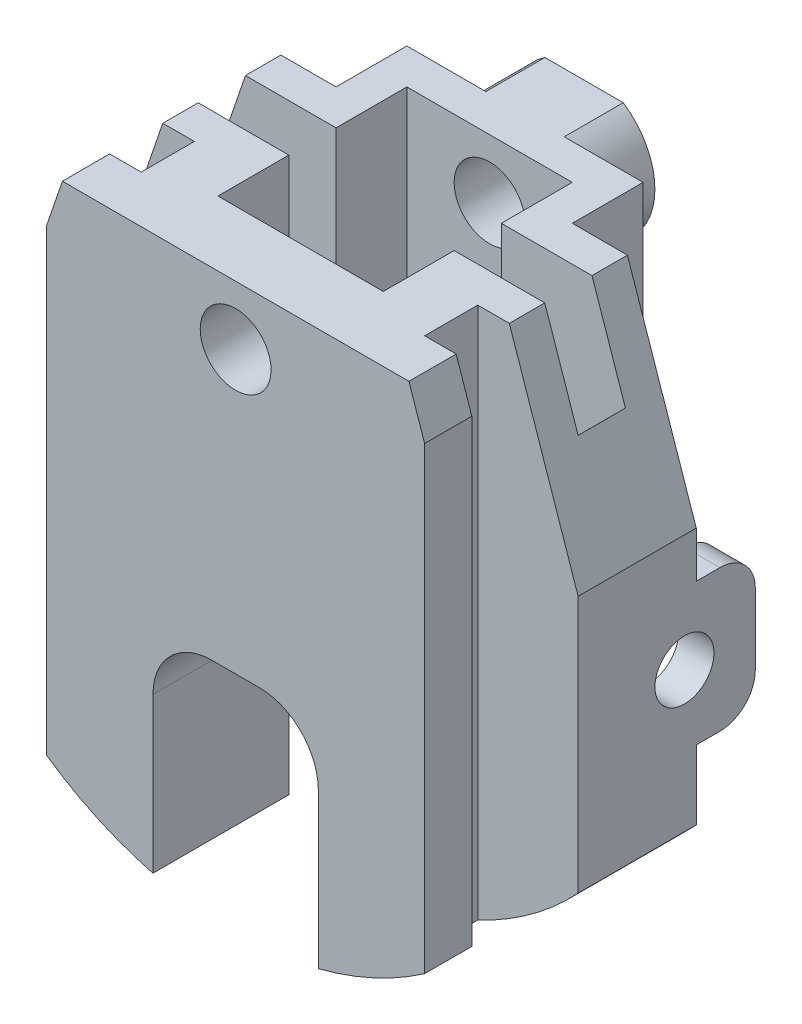
from build123d import *

# Parameters (mm, degrees)
BOSS_EXTRUDE1_DEPTH     = 18
SKETCH2_R               = 3
BOSS_EXTRUDE2_DEPTH     = 5
SKETCH2_3_R             = 3
CUT_EXTRUDE1_DEPTH      = 49.664668909
SKETCH1_3_W             = 2
SKETCH1_3_H             = 4.5
BOSS_EXTRUDE3_DEPTH     = 30
SKETCH3_OUTSIDE_W       = 56.936
SKETCH3_OUTSIDE_H       = 63.936
SKETCH3_OUTSIDE_R       = 28
CUT_EXTRUDE2_DEPTH      = 57.69435598
CUT_EXTRUDE3_START      = -18.5
CUT_EXTRUDE3_DEPTH      = 18.5
CUT_EXTRUDE4_DEPTH      = 57.587476675
CUT_EXTRUDE4_DEPTH_BACK = 10
SKETCH7_R               = 2.5
BOSS_EXTRUDE4_DEPTH     = 3
BOSS_EXTRUDE6_START     = -3
BOSS_EXTRUDE6_DEPTH     = 3
BOSS_EXTRUDE7_START     = -3
BOSS_EXTRUDE7_DEPTH     = 3
BOSS_EXTRUDE8_START     = -3
BOSS_EXTRUDE8_DEPTH     = 3
CUT_EXTRUDE5_DEPTH      = 43.804159814
CUT_EXTRUDE5_DEPTH_BACK = 43.804159814
SKETCH7_3_R             = 2.5


# Read off the part's stored shape, not the designer's step: Cut-Extrude3
with BuildPart() as part:
    # Sketch1 → Boss-Extrude1 (new body)
    with BuildSketch(Plane(origin=(0, 0, 0), x_dir=(1, 0, 0), z_dir=(0, 1, 0))):
        Polygon((7.5, 3), (-3, 3), (-3, -7), (5.5, -7), (5.5, -11.5), (1.5, -11.5), (1.5, -15.5), (33.5, -15.5), (33.5, -11.5), (29.5, -11.5), (29.5, -7), (38, -7), (38, 3), (27.5, 3), (27.5, 9), (7.5, 9), align=None)
        Polygon((24.5, 0), (35, 0), (35, -4), (24.5, -4), (24.5, -10), (10.5, -10), (10.5, -4), (0, -4), (0, 0), (10.5, 0), (10.5, 6), (24.5, 6), align=None, mode=Mode.SUBTRACT)
    extrude(amount=BOSS_EXTRUDE1_DEPTH)

    # Sketch2 → Boss-Extrude2 (add)
    with BuildSketch(Plane(origin=(0, 0, -9), x_dir=(-1, 0, 0), z_dir=(0, 0, -1))):
        with BuildLine():
            ThreePointArc((-20.81662479, 18), (-20.337274331, 7.713235926), (-11.5, 13))
            ThreePointArc((-11.5, 13), (-12.213235926, 15.837274331), (-14.18337521, 18))
            Line((-14.18337521, 18), (-20.81662479, 18))
        make_face()
        with Locations((-17.5, 13)):
            Circle(SKETCH2_R, mode=Mode.SUBTRACT)
    extrude(amount=BOSS_EXTRUDE2_DEPTH)

    # Sketch2<3> → Cut-Extrude1 (cut, through all)
    with BuildSketch(Plane(origin=(0, 0, -9), x_dir=(-1, 0, 0), z_dir=(0, 0, -1))):
        with Locations((-17.5, 13)):
            Circle(SKETCH2_3_R)
    extrude(amount=-CUT_EXTRUDE1_DEPTH, mode=Mode.SUBTRACT)

    # Sketch1<3> → Boss-Extrude3 (add)
    with BuildSketch(Plane(origin=(0, 0, 0), x_dir=(1, 0, 0), z_dir=(0, 1, 0))):
        Polygon((0, -4), (0, 0), (0, 3), (-3, 3), (-3, -7), (5.5, -7), (7.5, -7), (7.5, -11.5), (7.5, -13), (27.5, -13), (27.5, -11.5), (27.5, -7), (29.5, -7), (38, -7), (38, 3), (35, 3), (35, 0), (35, -4), (24.5, -4), (24.5, -10), (10.5, -10), (10.5, -4), align=None)
        with Locations((28.5, -9.25)):
            Rectangle(SKETCH1_3_W, SKETCH1_3_H)
        Polygon((7.5, -11.5), (5.5, -11.5), (1.5, -11.5), (1.5, -15.5), (33.5, -15.5), (33.5, -11.5), (29.5, -11.5), (27.5, -11.5), (27.5, -13), (7.5, -13), align=None)
        with Locations((6.5, -9.25)):
            Rectangle(SKETCH1_3_W, SKETCH1_3_H)
    extrude(amount=-BOSS_EXTRUDE3_DEPTH)

    # Sketch3 outside → Cut-Extrude2 (cut, through all)
    with BuildSketch(Plane.XY.offset(15.5)):
        with Locations((17.5, -6)):
            Rectangle(SKETCH3_OUTSIDE_W, SKETCH3_OUTSIDE_H)
        with Locations((17.5, -1.797525342)):
            Circle(SKETCH3_OUTSIDE_R, mode=Mode.SUBTRACT)
    extrude(amount=-CUT_EXTRUDE2_DEPTH, mode=Mode.SUBTRACT)

    # Cut-Extrude3 outline → Cut-Extrude3 (cut)
    with BuildSketch(Plane.XY.offset(15.5).offset(CUT_EXTRUDE3_START)):
        with BuildLine():
            Line((32.171400751, 18), (38, 0.89725692))
            Line((38, 0.89725692), (38, 17.274705781))
            ThreePointArc((38, 17.274705781), (37.653490195, 17.640500097), (37.300454296, 18))
            Line((37.300454296, 18), (32.171400751, 18))
        make_face()
        with BuildLine():
            Line((2.828599249, 18), (-2.300454296, 18))
            ThreePointArc((-2.300454296, 18), (-2.653490195, 17.640500097), (-3, 17.274705781))
            Line((-3, 17.274705781), (-3, 0.89725692))
            Line((-3, 0.89725692), (2.828599249, 18))
        make_face()
    extrude(amount=CUT_EXTRUDE3_DEPTH, mode=Mode.SUBTRACT)

    # Sketch5 → Cut-Extrude4 (cut, two sides: drawn at the far end of the back side and taken through both)
    with BuildSketch(Plane.XY.offset(15.5).offset(-CUT_EXTRUDE4_DEPTH_BACK)):
        with BuildLine():
            ThreePointArc((10.5, -28.908408765), (17.5, -29.797525342), (24.5, -28.908408765))
            Line((24.5, -28.908408765), (24.5, -15.797525342))
            ThreePointArc((24.5, -15.797525342), (23.035533906, -12.261991436), (19.5, -10.797525342))
            Line((19.5, -10.797525342), (15.5, -10.797525342))
            ThreePointArc((15.5, -10.797525342), (11.964466094, -12.261991436), (10.5, -15.797525342))
            Line((10.5, -15.797525342), (10.5, -28.908408765))
        make_face()
    extrude(amount=CUT_EXTRUDE4_DEPTH + CUT_EXTRUDE4_DEPTH_BACK, mode=Mode.SUBTRACT)

    # Sketch7 → Boss-Extrude4 (add)
    # profile 1 of 2: a face of its own
    with BuildSketch(Plane.ZY.offset(-24.5)):
        with BuildLine():
            Line((-5, -15), (4, -15))
            Line((4, -15), (4, -3))
            Line((4, -3), (-5, -3))
            ThreePointArc((-5, -3), (-7.121320344, -3.878679656), (-8, -6))
            Line((-8, -6), (-8, -12))
            ThreePointArc((-8, -12), (-7.121320344, -14.121320344), (-5, -15))
        make_face()
        with Locations((-2, -9)):
            Circle(SKETCH7_R, mode=Mode.SUBTRACT)
    # profile 2 of 2: a face of its own
    with BuildSketch(Plane.ZY.offset(-24.5)):
        with Locations((-2, -9)):
            Circle(SKETCH7_R)
    extrude(amount=-BOSS_EXTRUDE4_DEPTH)

    # Sketch9 → Boss-Extrude6 (add)
    with BuildSketch(Plane(origin=(10.5, 0, 0), x_dir=(0, 0, -1), z_dir=(1, 0, 0)).offset(BOSS_EXTRUDE6_START)):
        with BuildLine():
            Line((-4, -15), (5, -15))
            ThreePointArc((5, -15), (7.121320344, -14.121320344), (8, -12))
            Line((8, -12), (8, -6))
            ThreePointArc((8, -6), (7.121320344, -3.878679656), (5, -3))
            Line((5, -3), (-4, -3))
            Line((-4, -3), (-4, -15))
        make_face()
    extrude(amount=BOSS_EXTRUDE6_DEPTH)

    # Sketch10 → Boss-Extrude7 (add)
    with BuildSketch(Plane.ZY.offset(-35).offset(BOSS_EXTRUDE7_START)):
        with BuildLine():
            Line((-5, -15), (-3, -15))
            Line((-3, -15), (-3, -3))
            Line((-3, -3), (-5, -3))
            ThreePointArc((-5, -3), (-7.121320344, -3.878679656), (-8, -6))
            Line((-8, -6), (-8, -12))
            ThreePointArc((-8, -12), (-7.121320344, -14.121320344), (-5, -15))
        make_face()
    extrude(amount=BOSS_EXTRUDE7_DEPTH)

    # Sketch11 → Boss-Extrude8 (add)
    with BuildSketch(Plane(origin=(0, 0, 0), x_dir=(0, 0, -1), z_dir=(1, 0, 0)).offset(BOSS_EXTRUDE8_START)):
        with BuildLine():
            Line((5, -3), (3, -3))
            Line((3, -3), (3, -6.708712153))
            ThreePointArc((3, -6.708712153), (4.091650066, -7.630693606), (4.5, -9))
            ThreePointArc((4.5, -9), (4.091650066, -10.369306394), (3, -11.291287847))
            Line((3, -11.291287847), (3, -15))
            Line((3, -15), (5, -15))
            ThreePointArc((5, -15), (7.121320344, -14.121320344), (8, -12))
            Line((8, -12), (8, -6))
            ThreePointArc((8, -6), (7.121320344, -3.878679656), (5, -3))
        make_face()
        with BuildLine():
            ThreePointArc((4.5, -9), (4.091650066, -7.630693606), (3, -6.708712153))
            Line((3, -6.708712153), (3, -11.291287847))
            ThreePointArc((3, -11.291287847), (4.091650066, -10.369306394), (4.5, -9))
        make_face()
        with BuildLine():
            Line((3, -11.291287847), (3, -6.708712153))
            ThreePointArc((3, -6.708712153), (-0.5, -9), (3, -11.291287847))
        make_face()
    extrude(amount=BOSS_EXTRUDE8_DEPTH)

    # Sketch7<3> → Cut-Extrude5 (cut, two sides: drawn at the far end of the back side and taken through both)
    with BuildSketch(Plane.ZY.offset(-24.5).offset(-CUT_EXTRUDE5_DEPTH_BACK)):
        with Locations((-2, -9)):
            Circle(SKETCH7_3_R)
    extrude(amount=CUT_EXTRUDE5_DEPTH + CUT_EXTRUDE5_DEPTH_BACK, mode=Mode.SUBTRACT)


solid = part.part
